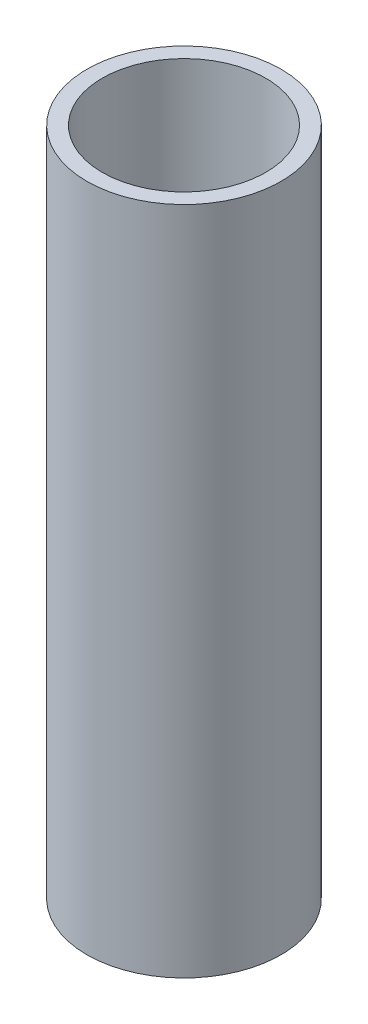
from build123d import *

# Parameters (mm, degrees)
SKETCH_1_R          = 21.75
EXTRUDE_1_DEPTH     = 150
SKETCH_2_R          = 18.3
CUT_EXTRUDE_1_DEPTH = 33
CUT_EXTRUDE_START   = -33
SKETCH_3_R          = 18.3
CUT_EXTRUDE_2_DEPTH = 33


with BuildPart() as part:
    # 草图1 → 凸台-拉伸1 (new body)
    with BuildSketch(Plane(origin=(0, 0, 0), x_dir=(1, 0, 0), z_dir=(0, 1, 0))):
        Circle(SKETCH_1_R)
    extrude(amount=EXTRUDE_1_DEPTH)

    # 草图2 → 切除-拉伸1 (cut)
    with BuildSketch(Plane(origin=(0, 150, 0), x_dir=(1, 0, 0), z_dir=(0, 1, 0))):
        Circle(SKETCH_2_R)
    extrude(amount=-CUT_EXTRUDE_1_DEPTH, mode=Mode.SUBTRACT)

    # 草图3 → 切除-拉伸2 (cut)
    with BuildSketch(Plane.XZ.offset(CUT_EXTRUDE_START)):
        Circle(SKETCH_3_R)
    extrude(amount=CUT_EXTRUDE_2_DEPTH, mode=Mode.SUBTRACT)


solid = part.part
